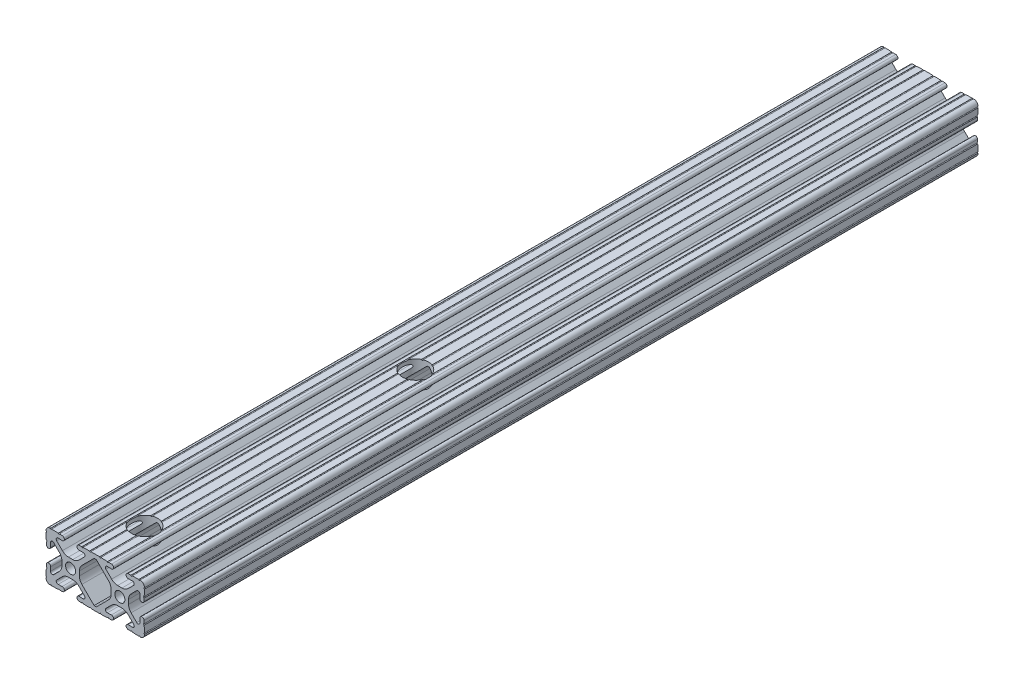
from build123d import *

# Parameters (mm, degrees)
SKETCH3_R          = 2.6035
EXTRUDE1_DEPTH     = 430
SKETCH4_R          = 6.75
CUT_EXTRUDE2_DEPTH = 433.431152459


with BuildPart() as part:
    # Sketch3 → Extrude1 (new body)
    with BuildSketch(Plane.XY):
        with BuildLine():
            Line((-1.115277175, 4.5085), (1.115277175, 4.5085))
            ThreePointArc((1.115277175, 4.5085), (2.806584872, 4.844922018), (4.240406305, 5.80297087))
            Line((4.240406305, 5.80297087), (7.148423664, 8.710988229))
            ThreePointArc((7.148423664, 8.710988229), (7.349906316, 9.772227925), (6.436353897, 10.348636575))
            Line((6.436353897, 10.348636575), (4.381960454, 10.276895575))
            ThreePointArc((4.381960454, 10.276895575), (3.239173075, 11.342562046), (4.304839546, 12.485349424))
            Line((4.304839546, 12.485349424), (5.728246175, 12.535055879))
            ThreePointArc((5.728246175, 12.535055879), (6.054756855, 12.230579745), (6.35923299, 12.557090424))
            Line((6.35923299, 12.557090424), (9.782092278, 12.676619304))
            ThreePointArc((9.782092278, 12.676619304), (10.108602958, 12.37214317), (10.413079092, 12.69865385))
            Line((10.413079092, 12.69865385), (14.986920908, 12.69865385))
            ThreePointArc((14.986920908, 12.69865385), (15.291397042, 12.37214317), (15.617907722, 12.676619304))
            Line((15.617907722, 12.676619304), (19.04076701, 12.557090424))
            ThreePointArc((19.04076701, 12.557090424), (19.345243145, 12.230579745), (19.671753825, 12.535055879))
            Line((19.671753825, 12.535055879), (21.095160454, 12.485349424))
            ThreePointArc((21.095160454, 12.485349424), (22.160826925, 11.342562046), (21.018039546, 10.276895575))
            Line((21.018039546, 10.276895575), (18.963646103, 10.348636575))
            ThreePointArc((18.963646103, 10.348636575), (18.050093684, 9.772227925), (18.251576336, 8.710988229))
            Line((18.251576336, 8.710988229), (21.159593695, 5.80297087))
            ThreePointArc((21.159593695, 5.80297087), (22.593415128, 4.844922018), (24.284722825, 4.5085))
            Line((24.284722825, 4.5085), (26.515277175, 4.5085))
            ThreePointArc((26.515277175, 4.5085), (28.206584872, 4.844922018), (29.640406305, 5.80297087))
            Line((29.640406305, 5.80297087), (32.548423664, 8.710988229))
            ThreePointArc((32.548423664, 8.710988229), (32.749906316, 9.772227925), (31.836353897, 10.348636575))
            Line((31.836353897, 10.348636575), (29.781960454, 10.276895575))
            ThreePointArc((29.781960454, 10.276895575), (28.639173075, 11.342562046), (29.704839546, 12.485349424))
            Line((29.704839546, 12.485349424), (31.128246175, 12.535055879))
            ThreePointArc((31.128246175, 12.535055879), (31.454756855, 12.230579745), (31.75923299, 12.557090424))
            Line((31.75923299, 12.557090424), (35.182092278, 12.676619304))
            ThreePointArc((35.182092278, 12.676619304), (35.508602958, 12.37214317), (35.813079092, 12.69865385))
            ThreePointArc((35.813079092, 12.69865385), (37.452764565, 12.052764565), (38.09865385, 10.413079092))
            ThreePointArc((38.09865385, 10.413079092), (37.77214317, 10.108602958), (38.076619304, 9.782092278))
            Line((38.076619304, 9.782092278), (37.957090424, 6.35923299))
            ThreePointArc((37.957090424, 6.35923299), (37.630579745, 6.054756855), (37.935055879, 5.728246175))
            Line((37.935055879, 5.728246175), (37.885349424, 4.304839546))
            ThreePointArc((37.885349424, 4.304839546), (36.742562046, 3.239173075), (35.676895575, 4.381960454))
            Line((35.676895575, 4.381960454), (35.748636575, 6.436353897))
            ThreePointArc((35.748636575, 6.436353897), (35.172227925, 7.349906316), (34.110988229, 7.148423664))
            Line((34.110988229, 7.148423664), (31.202970856, 4.240406291))
            ThreePointArc((31.202970856, 4.240406291), (30.244922014, 2.806584863), (29.9085, 1.115277175))
            Line((29.9085, 1.115277175), (29.9085, -1.115277175))
            ThreePointArc((29.9085, -1.115277175), (30.244922014, -2.806584863), (31.202970856, -4.240406291))
            Line((31.202970856, -4.240406291), (34.110988229, -7.148423664))
            ThreePointArc((34.110988229, -7.148423664), (35.172227925, -7.349906316), (35.748636575, -6.436353897))
            Line((35.748636575, -6.436353897), (35.676895575, -4.381960454))
            ThreePointArc((35.676895575, -4.381960454), (36.742562046, -3.239173075), (37.885349424, -4.304839546))
            Line((37.885349424, -4.304839546), (37.935055879, -5.728246175))
            ThreePointArc((37.935055879, -5.728246175), (37.630579745, -6.054756855), (37.957090424, -6.35923299))
            Line((37.957090424, -6.35923299), (38.076619304, -9.782092278))
            ThreePointArc((38.076619304, -9.782092278), (37.77214317, -10.108602958), (38.09865385, -10.413079092))
            ThreePointArc((38.09865385, -10.413079092), (37.452764565, -12.052764565), (35.813079092, -12.69865385))
            ThreePointArc((35.813079092, -12.69865385), (35.508602958, -12.37214317), (35.182092278, -12.676619304))
            Line((35.182092278, -12.676619304), (31.75923299, -12.557090424))
            ThreePointArc((31.75923299, -12.557090424), (31.454756855, -12.230579745), (31.128246175, -12.535055879))
            Line((31.128246175, -12.535055879), (29.704839546, -12.485349424))
            ThreePointArc((29.704839546, -12.485349424), (28.639173075, -11.342562046), (29.781960454, -10.276895575))
            Line((29.781960454, -10.276895575), (31.836353897, -10.348636575))
            ThreePointArc((31.836353897, -10.348636575), (32.749906316, -9.772227925), (32.548423664, -8.710988229))
            Line((32.548423664, -8.710988229), (29.640406305, -5.80297087))
            ThreePointArc((29.640406305, -5.80297087), (28.206584872, -4.844922018), (26.515277175, -4.5085))
            Line((26.515277175, -4.5085), (24.284722825, -4.5085))
            ThreePointArc((24.284722825, -4.5085), (22.593415128, -4.844922018), (21.159593695, -5.80297087))
            Line((21.159593695, -5.80297087), (18.251576336, -8.710988229))
            ThreePointArc((18.251576336, -8.710988229), (18.050093684, -9.772227925), (18.963646103, -10.348636575))
            Line((18.963646103, -10.348636575), (21.018039546, -10.276895575))
            ThreePointArc((21.018039546, -10.276895575), (22.160826925, -11.342562046), (21.095160454, -12.485349424))
            Line((21.095160454, -12.485349424), (19.671753825, -12.535055879))
            ThreePointArc((19.671753825, -12.535055879), (19.345243145, -12.230579745), (19.04076701, -12.557090424))
            Line((19.04076701, -12.557090424), (15.617907722, -12.676619304))
            ThreePointArc((15.617907722, -12.676619304), (15.291397042, -12.37214317), (14.986920908, -12.69865385))
            Line((14.986920908, -12.69865385), (10.413079092, -12.69865385))
            ThreePointArc((10.413079092, -12.69865385), (10.108602958, -12.37214317), (9.782092278, -12.676619304))
            Line((9.782092278, -12.676619304), (6.35923299, -12.557090424))
            ThreePointArc((6.35923299, -12.557090424), (6.054756855, -12.230579745), (5.728246175, -12.535055879))
            Line((5.728246175, -12.535055879), (4.304839546, -12.485349424))
            ThreePointArc((4.304839546, -12.485349424), (3.239173075, -11.342562046), (4.381960454, -10.276895575))
            Line((4.381960454, -10.276895575), (6.436353897, -10.348636575))
            ThreePointArc((6.436353897, -10.348636575), (7.349906316, -9.772227925), (7.148423664, -8.710988229))
            Line((7.148423664, -8.710988229), (4.240406305, -5.80297087))
            ThreePointArc((4.240406305, -5.80297087), (2.806584872, -4.844922018), (1.115277175, -4.5085))
            Line((1.115277175, -4.5085), (-1.115277175, -4.5085))
            ThreePointArc((-1.115277175, -4.5085), (-2.806584872, -4.844922018), (-4.240406305, -5.80297087))
            Line((-4.240406305, -5.80297087), (-7.148423664, -8.710988229))
            ThreePointArc((-7.148423664, -8.710988229), (-7.349906316, -9.772227925), (-6.436353897, -10.348636575))
            Line((-6.436353897, -10.348636575), (-4.381960454, -10.276895575))
            ThreePointArc((-4.381960454, -10.276895575), (-3.239173075, -11.342562046), (-4.304839546, -12.485349424))
            Line((-4.304839546, -12.485349424), (-5.728246175, -12.535055879))
            ThreePointArc((-5.728246175, -12.535055879), (-6.054756855, -12.230579745), (-6.35923299, -12.557090424))
            Line((-6.35923299, -12.557090424), (-9.782092278, -12.676619304))
            ThreePointArc((-9.782092278, -12.676619304), (-10.108602958, -12.37214317), (-10.413079092, -12.69865385))
            ThreePointArc((-10.413079092, -12.69865385), (-12.052764565, -12.052764565), (-12.69865385, -10.413079092))
            ThreePointArc((-12.69865385, -10.413079092), (-12.37214317, -10.108602958), (-12.676619304, -9.782092278))
            Line((-12.676619304, -9.782092278), (-12.557090424, -6.35923299))
            ThreePointArc((-12.557090424, -6.35923299), (-12.230579745, -6.054756855), (-12.535055879, -5.728246175))
            Line((-12.535055879, -5.728246175), (-12.485349424, -4.304839546))
            ThreePointArc((-12.485349424, -4.304839546), (-11.342562046, -3.239173075), (-10.276895575, -4.381960454))
            Line((-10.276895575, -4.381960454), (-10.348636575, -6.436353897))
            ThreePointArc((-10.348636575, -6.436353897), (-9.772227925, -7.349906316), (-8.710988229, -7.148423664))
            Line((-8.710988229, -7.148423664), (-5.802970856, -4.240406291))
            ThreePointArc((-5.802970856, -4.240406291), (-4.844922014, -2.806584863), (-4.5085, -1.115277175))
            Line((-4.5085, -1.115277175), (-4.5085, 1.115277175))
            ThreePointArc((-4.5085, 1.115277175), (-4.844922014, 2.806584863), (-5.802970856, 4.240406291))
            Line((-5.802970856, 4.240406291), (-8.710988229, 7.148423664))
            ThreePointArc((-8.710988229, 7.148423664), (-9.772227925, 7.349906316), (-10.348636575, 6.436353897))
            Line((-10.348636575, 6.436353897), (-10.276895575, 4.381960454))
            ThreePointArc((-10.276895575, 4.381960454), (-11.342562046, 3.239173075), (-12.485349424, 4.304839546))
            Line((-12.485349424, 4.304839546), (-12.535055879, 5.728246175))
            ThreePointArc((-12.535055879, 5.728246175), (-12.230579745, 6.054756855), (-12.557090424, 6.35923299))
            Line((-12.557090424, 6.35923299), (-12.676619304, 9.782092278))
            ThreePointArc((-12.676619304, 9.782092278), (-12.37214317, 10.108602958), (-12.69865385, 10.413079092))
            ThreePointArc((-12.69865385, 10.413079092), (-12.052764565, 12.052764565), (-10.413079092, 12.69865385))
            ThreePointArc((-10.413079092, 12.69865385), (-10.108602958, 12.37214317), (-9.782092278, 12.676619304))
            Line((-9.782092278, 12.676619304), (-6.35923299, 12.557090424))
            ThreePointArc((-6.35923299, 12.557090424), (-6.054756855, 12.230579745), (-5.728246175, 12.535055879))
            Line((-5.728246175, 12.535055879), (-4.304839546, 12.485349424))
            ThreePointArc((-4.304839546, 12.485349424), (-3.239173075, 11.342562046), (-4.381960454, 10.276895575))
            Line((-4.381960454, 10.276895575), (-6.436353897, 10.348636575))
            ThreePointArc((-6.436353897, 10.348636575), (-7.349906316, 9.772227925), (-7.148423664, 8.710988229))
            Line((-7.148423664, 8.710988229), (-4.240406305, 5.80297087))
            ThreePointArc((-4.240406305, 5.80297087), (-2.806584872, 4.844922018), (-1.115277175, 4.5085))
        make_face()
        with Locations((25.4, 0)):
            Circle(SKETCH3_R, mode=Mode.SUBTRACT)
        Circle(SKETCH3_R, mode=Mode.SUBTRACT)
        with BuildLine():
            Line((5.802970856, 4.240406291), (12.109304956, 10.546740391))
            Line((12.109304956, 10.546740391), (12.7, 10.567367916))
            Line((12.7, 10.567367916), (13.290695044, 10.546740391))
            Line((13.290695044, 10.546740391), (19.597029144, 4.240406291))
            ThreePointArc((19.597029144, 4.240406291), (20.555077986, 2.806584863), (20.8915, 1.115277175))
            Line((20.8915, 1.115277175), (20.8915, -1.115277175))
            ThreePointArc((20.8915, -1.115277175), (20.555077986, -2.806584863), (19.597029144, -4.240406291))
            Line((19.597029144, -4.240406291), (13.290695044, -10.546740391))
            Line((13.290695044, -10.546740391), (12.7, -10.567367916))
            Line((12.7, -10.567367916), (12.109304956, -10.546740391))
            Line((12.109304956, -10.546740391), (5.802970856, -4.240406291))
            ThreePointArc((5.802970856, -4.240406291), (4.844922014, -2.806584863), (4.5085, -1.115277175))
            Line((4.5085, -1.115277175), (4.5085, 1.115277175))
            ThreePointArc((4.5085, 1.115277175), (4.844922014, 2.806584863), (5.802970856, 4.240406291))
        make_face(mode=Mode.SUBTRACT)
    extrude(amount=EXTRUDE1_DEPTH)

    # Sketch4 → Cut-Extrude2 (cut, through all)
    with BuildSketch(Plane(origin=(0, 12.69865385, 0), x_dir=(1, 0, 0), z_dir=(0, 1, 0))):
        with Locations((12.7, -404.6)):
            Circle(SKETCH4_R)
        with Locations((12.7, -264.9)):
            Circle(SKETCH4_R)
    extrude(amount=-CUT_EXTRUDE2_DEPTH, mode=Mode.SUBTRACT)


solid = part.part
